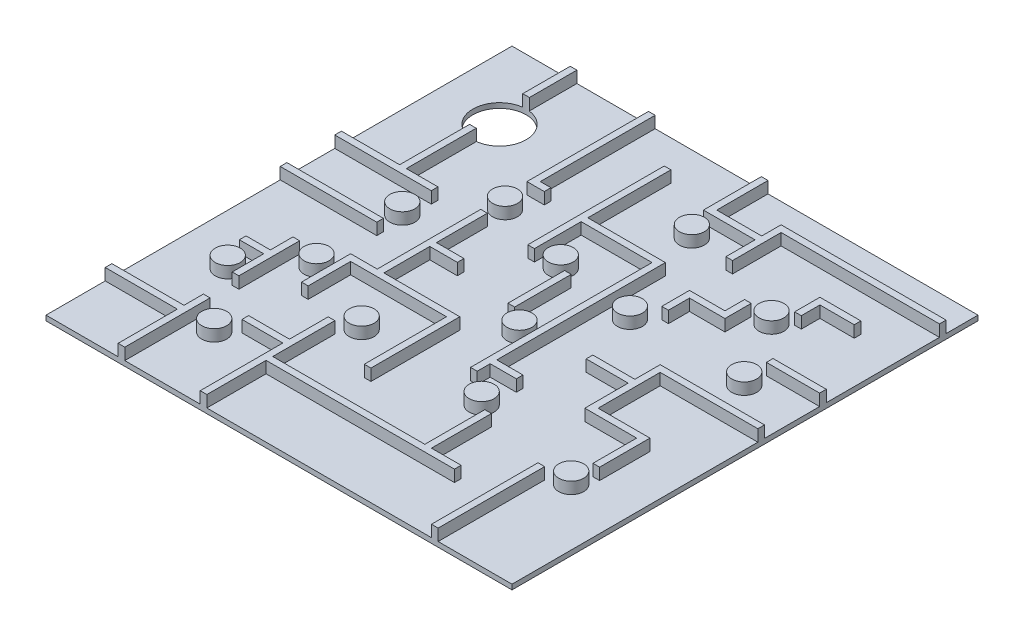
from build123d import *

# Parameters (mm, degrees)
SKETCH1_W           = 280
SKETCH1_H           = 280
SKETCH1_R           = 16
BOSS_EXTRUDE1_DEPTH = 1.5
SKETCH2_R           = 7.5
SKETCH2_W           = 58
SKETCH2_H           = 4
SKETCH2_W_2         = 4
SKETCH2_H_2         = 64
SKETCH2_W_3         = 32
SKETCH2_H_3         = 34
BOSS_EXTRUDE2_DEPTH = 7


with BuildPart() as part:
    # Sketch1 → Boss-Extrude1 (new, symmetric)
    with BuildSketch(Plane(origin=(0, 0, 0), x_dir=(1, 0, 0), z_dir=(0, 1, 0))):
        Rectangle(SKETCH1_W, SKETCH1_H)
        with Locations((-103, 95.5)):
            Circle(SKETCH1_R, mode=Mode.SUBTRACT)
    extrude(amount=BOSS_EXTRUDE1_DEPTH, both=True)

    # Sketch2 → Boss-Extrude2 (add)
    with BuildSketch(Plane(origin=(0, 1.5, 0), x_dir=(1, 0, 0), z_dir=(0, 1, 0))):
        with Locations((-56.992650147, 52.796676876)):
            Circle(SKETCH2_R)
        with Locations((-85.015047777, 19.118646283)):
            Circle(SKETCH2_R)
        with Locations((-83.738928303, -33.690548853)):
            Circle(SKETCH2_R)
        with Locations((-109.516269096, -61.269929812)):
            Circle(SKETCH2_R)
        with Locations((-80.69273369, -98.230062392)):
            Circle(SKETCH2_R)
        with Locations((-37.705685608, -52.627832678)):
            Circle(SKETCH2_R)
        with Locations((37.587423323, -55.831973409)):
            Circle(SKETCH2_R)
        with Locations((105.9104653, -70.333190482)):
            Circle(SKETCH2_R)
        with Locations((11.819316554, -7.352500668)):
            Circle(SKETCH2_R)
        with Locations((-9.755931913, 39.066973306)):
            Circle(SKETCH2_R)
        with Locations((13.883510801, 94.19984938)):
            Circle(SKETCH2_R)
        with Locations((82.624857116, 73.284632448)):
            Circle(SKETCH2_R)
        with Locations((37.587423323, 33.266850719)):
            Circle(SKETCH2_R)
        with Locations((106.252694304, 33.287862382)):
            Circle(SKETCH2_R)
        Polygon((-58, 140), (-58, 67), (-47.615867658, 67), (-47.615867658, 71), (-54, 71), (-54, 140), align=None)
        with BuildLine():
            Line((-101, 140), (-105, 140))
            Line((-105, 140), (-105, 111.374507866))
            ThreePointArc((-105, 111.374507866), (-103, 111.5), (-101, 111.374507866))
            Line((-101, 111.374507866), (-101, 140))
        make_face()
        with BuildLine():
            Line((-140, 37.501692911), (-105, 37.501692911))
            Line((-105, 37.501692911), (-105, 79.625492134))
            ThreePointArc((-105, 79.625492134), (-103, 79.5), (-101, 79.625492134))
            Line((-101, 79.625492134), (-101, 37.501692911))
            Line((-101, 37.501692911), (-82, 37.501692911))
            Line((-82, 37.501692911), (-82, 33.501692911))
            Line((-82, 33.501692911), (-140, 33.501692911))
            Line((-140, 33.501692911), (-140, 37.501692911))
        make_face()
        Polygon((-140, -100.418377476), (-96.668523278, -100.418377476), (-96.668523278, -88.738640334), (-92.668523278, -88.738640334), (-92.668523278, -140), (-96.668523278, -140), (-96.668523278, -104.418377476), (-140, -104.418377476), align=None)
        with Locations((-111, 2.735599655)):
            Rectangle(SKETCH2_W, SKETCH2_H)
        Polygon((-47.345115434, -140), (-47.345115434, -90.364557891), (-71.881878867, -90.364557891), (-71.881878867, -86.364557891), (-47.345115434, -86.364557891), (-47.345115434, -63.088559208), (-43.345115434, -63.088559208), (-43.345115434, -100.418377476), (48.027751829, -100.418377476), (48.027751829, -64.371939455), (52.027751829, -64.371939455), (52.027751829, -100.418377476), (69.827851451, -100.418377476), (69.827851451, -104.418377476), (-43.345115434, -104.418377476), (-43.345115434, -140), align=None)
        Polygon((140, 7.737266613), (81.293142587, 7.737266613), (81.293142587, -29.543544834), (112.431248518, -29.543544834), (112.431248518, -59.777272974), (108.431248518, -59.777272974), (108.431248518, -33.543544834), (77.293142587, -33.543544834), (77.293142587, -7.47679166), (52.027751829, -7.47679166), (52.027751829, -3.47679166), (77.293142587, -3.47679166), (77.293142587, 11.737266613), (140, 11.737266613), align=None)
        with Locations((93.622601552, -108)):
            Rectangle(SKETCH2_W_2, SKETCH2_H_2)
        Polygon((-99.510735812, -32.111868954), (-95.510735812, -32.111868954), (-95.510735812, -68.594238703), (-99.510735812, -68.594238703), (-99.510735812, -49.675826938), (-114.127069846, -49.675826938), (-114.127069846, -45.675826938), (-99.510735812, -45.675826938), align=None)
        with Locations((124, 46.843999527)):
            Rectangle(SKETCH2_W_3, SKETCH2_H)
        Polygon((-73.435195895, -53.042459291), (-69.435195895, -53.042459291), (-69.435195895, -27.528186601), (-11.837088751, -27.528186601), (-11.837088751, -76.919702569), (-7.837088751, -76.919702569), (-7.837088751, -23.528186601), (-53.440050937, -23.528186601), (-53.440050937, 4.043094912), (-36.882667743, 4.043094912), (-36.882667743, 8.043094912), (-53.440050937, 8.043094912), (-53.440050937, 38.63118777), (-57.440050937, 38.63118777), (-57.440050937, -23.528186601), (-73.435195895, -23.528186601), align=None)
        Polygon((114.833141636, 94.80128466), (114.833141636, 90.80128466), (94.203549623, 90.80128466), (94.203549623, 79.625492134), (90.203549623, 79.625492134), (90.203549623, 94.80128466), align=None)
        with Locations((1.57904958, 15.009472223)):
            Rectangle(SKETCH2_W_2, SKETCH2_H_3)
        Polygon((68.742119222, 71), (68.742119222, 59.19860167), (47.447056499, 59.19860167), (47.447056499, 42.554658178), (51.447056499, 42.554658178), (51.447056499, 55.19860167), (72.742119222, 55.19860167), (72.742119222, 71), align=None)
        Polygon((21.727135977, -46.6315684), (25.727135977, -46.6315684), (25.727135977, -38.844500644), (41.459511743, -38.844500644), (41.459511743, -34.844500644), (25.727135977, -34.844500644), (25.727135977, 66.420221849), (-20.87255933, 66.420221849), (-20.87255933, 116.344219933), (-24.87255933, 116.344219933), (-24.87255933, 34.358038326), (-20.87255933, 34.358038326), (-20.87255933, 62.420221849), (21.727135977, 62.420221849), align=None)
        Polygon((140, 116.845058218), (44.841725693, 116.845058218), (44.841725693, 87.65657302), (40.841725693, 87.65657302), (40.841725693, 105.182034885), (9.848778982, 105.182034885), (9.848778982, 140), (13.848778982, 140), (13.848778982, 109.182034885), (40.841725693, 109.182034885), (40.841725693, 120.845058218), (140, 120.845058218), align=None)
    extrude(amount=BOSS_EXTRUDE2_DEPTH)


solid = part.part
